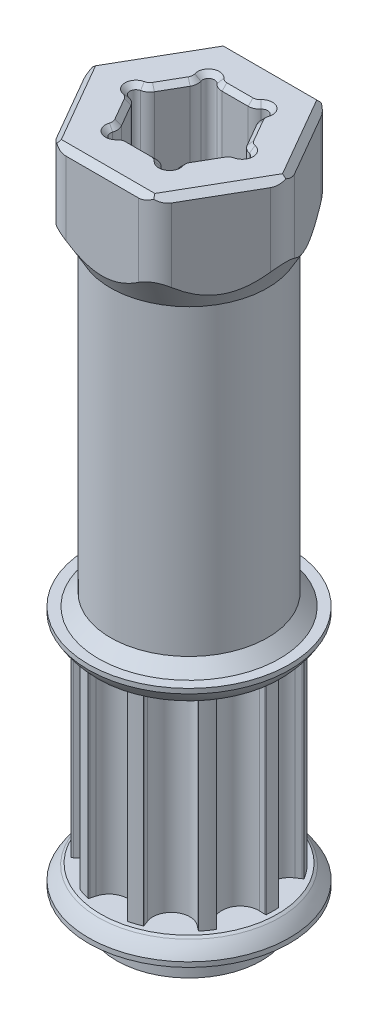
from build123d import *

# Parameters (mm, degrees)
SKETCH1_R           = 4.393648446
TOOTHOD_DEPTH       = 5.334
TOOTHPROFILE_DEPTH  = 9.189007835
TOOTHPATTERN_COUNT  = 10
BORE_DEPTH          = 10.804858556
BORE_DEPTH_BACK     = 10.804858556
SKETCH10_R          = 3.81
BOSS_EXTRUDE1_DEPTH = 1.524
SKETCH11_R          = 4.1275
BOSS_EXTRUDE2_DEPTH = 18.9738
BOSS_EXTRUDE3_DEPTH = 3.175
SKETCH12_R          = 0.3175
CUT_EXTRUDE1_DEPTH  = 38.132106473
FILLET1_R           = 0.635
CHAMFER2_SIZE       = 0.254
CHAMFER1_SIZE       = 0.635
CHAMFER3_SIZE       = 2.419674978
CHAMFER3_SIZE_2     = 1.397
CHAMFER4_SIZE       = 0.3175
FILLET2_R           = 1.27


with BuildPart() as part:
    # Sketch1 → ToothOD (new, symmetric)
    with BuildSketch(Plane(origin=(0, 0, 0), x_dir=(1, 0, 0), z_dir=(0, 1, 0))):
        with Locations(Location((0, 0, 0), (0, 0, 270))):
            Circle(SKETCH1_R)
    extrude(amount=TOOTHOD_DEPTH, both=True)

    # Sketch2 → ToothProfile (cut, symmetric)
    with BuildSketch(Plane(origin=(0, 0, 0), x_dir=(1, 0, 0), z_dir=(0, 1, 0))):
        with BuildLine():
            ThreePointArc((-0.937033068, 3.943710441), (-0.590385173, 3.425535831), (0, 3.225248446))
            ThreePointArc((0, 3.225248446), (0.590385173, 3.425535831), (0.937033068, 3.943710441))
            ThreePointArc((0.937033068, 3.943710441), (0.971699064, 4.069821903), (1.007805813, 4.195528446))
            ThreePointArc((1.007805813, 4.195528446), (1.021661234, 4.233200647), (1.040426249, 4.268683624))
            ThreePointArc((1.040426249, 4.268683624), (0, 4.393648446), (-1.040426249, 4.268683624))
            ThreePointArc((-1.040426249, 4.268683624), (-1.021661234, 4.233200647), (-1.007805813, 4.195528446))
            ThreePointArc((-1.007805813, 4.195528446), (-0.971699064, 4.069821903), (-0.937033068, 3.943710441))
        make_face()
    toothprofile = extrude(amount=TOOTHPROFILE_DEPTH, both=True, mode=Mode.SUBTRACT)

    # ToothPattern: ToothProfile ×10 about axis
    toothpattern_axis = Axis((0, 0, 0), (0, 1, 0))
    for i in range(1, TOOTHPATTERN_COUNT):
        add(toothprofile.rotate(toothpattern_axis, i * 360 / TOOTHPATTERN_COUNT), mode=Mode.SUBTRACT)

    # Sketch4 → Flange (revolve)
    with BuildSketch(Plane.XY, mode=Mode.PRIVATE) as flange_sk:
        with BuildLine():
            Line((0, -5.334), (4.647648446, -5.334))
            ThreePointArc((4.647648446, -5.334), (4.711861502, -5.379341157), (4.774648446, -5.426637424))
            ThreePointArc((4.774648446, -5.426637424), (5.050690043, -5.74459066), (5.282648446, -6.096))
            Line((5.282648446, -6.096), (5.282648446, -6.35))
            Line((5.282648446, -6.35), (0, -6.35))
            Line((0, -6.35), (0, -5.334))
        make_face()
        with BuildLine():
            Line((5.282648446, 6.35), (5.282648446, 6.096))
            ThreePointArc((5.282648446, 6.096), (5.050690043, 5.74459066), (4.774648446, 5.426637424))
            ThreePointArc((4.774648446, 5.426637424), (4.711861502, 5.379341157), (4.647648446, 5.334))
            Line((4.647648446, 5.334), (0, 5.334))
            Line((0, 5.334), (0, 6.35))
            Line((0, 6.35), (5.282648446, 6.35))
        make_face()
    revolve(flange_sk.sketch.rotate(Axis((0, 8.73125, 0), (0, -1, 0)), 90), axis=Axis((0, 8.73125, 0), (0, -1, 0)))

    # Sketch7 → Bore (cut, two sides: drawn at the far end of the back side and taken through both)
    with BuildSketch(Plane.XZ.offset(-BORE_DEPTH_BACK)):
        Polygon((1.396812374, 2.41935), (-1.396812374, 2.41935), (-2.793624748, 0), (-1.396812374, -2.41935), (1.396812374, -2.41935), (2.793624748, 0), align=None)
    extrude(amount=BORE_DEPTH + BORE_DEPTH_BACK, mode=Mode.SUBTRACT)

    # Sketch10 → Boss-Extrude1 (add)
    with BuildSketch(Plane.XZ.offset(6.35)):
        with Locations(Location((0, 0, 0), (0, 0, 90))):
            Circle(SKETCH10_R)
        Polygon((1.396812374, 2.41935), (-1.396812374, 2.41935), (-2.793624748, 0), (-1.396812374, -2.41935), (1.396812374, -2.41935), (2.793624748, 0), align=None, mode=Mode.SUBTRACT)
    extrude(amount=BOSS_EXTRUDE1_DEPTH)

    # Sketch11 → Boss-Extrude2 (add)
    with BuildSketch(Plane(origin=(0, 6.35, 0), x_dir=(1, 0, 0), z_dir=(0, 1, 0))):
        with Locations(Location((0, 0, 0), (0, 0, 90))):
            Circle(SKETCH11_R)
        Polygon((2.793624748, 0), (1.396812374, 2.41935), (-1.396812374, 2.41935), (-2.793624748, 0), (-1.396812374, -2.41935), (1.396812374, -2.41935), align=None, mode=Mode.SUBTRACT)
    extrude(amount=BOSS_EXTRUDE2_DEPTH)

    # Sketch14 → Boss-Extrude3 (add)
    with BuildSketch(Plane(origin=(0, 25.3238, 0), x_dir=(1, 0, 0), z_dir=(0, 1, 0))):
        Polygon((2.639645431, -4.572), (5.279290861, 0), (2.639645431, 4.572), (-2.639645431, 4.572), (-5.279290861, 0), (-2.639645431, -4.572), align=None)
        Polygon((-1.396812374, 2.41935), (-2.793624748, 0), (-1.396812374, -2.41935), (1.396812374, -2.41935), (2.793624748, 0), (1.396812374, 2.41935), align=None, mode=Mode.SUBTRACT)
    extrude(amount=BOSS_EXTRUDE3_DEPTH)

    # Sketch12 → Cut-Extrude1 (cut, through all)
    with BuildSketch(Plane.XZ.offset(7.874)):
        with Locations((-1.396812374, 2.41935)):
            Circle(SKETCH12_R)
        with Locations((1.396812374, 2.41935)):
            Circle(SKETCH12_R)
        with Locations((2.793624748, 0)):
            Circle(SKETCH12_R)
        with Locations((1.396812374, -2.41935)):
            Circle(SKETCH12_R)
        with Locations((-1.396812374, -2.41935)):
            Circle(SKETCH12_R)
        with Locations((-2.793624748, 0)):
            Circle(SKETCH12_R)
    extrude(amount=-CUT_EXTRUDE1_DEPTH, mode=Mode.SUBTRACT)

    # Fillet1
    fillet1_edges = [part.edges().sort_by_distance(p)[0] for p in [
        (-2.634874748, 10.3124, -0.274963066),
        (-2.634874748, 10.3124, 0.274963066),
        (-1.079312374, 10.3124, -2.41935),
        (-1.555562374, 10.3124, -2.144386934),
        (1.555562374, 10.3124, -2.144386934),
        (1.079312374, 10.3124, -2.41935),
        (2.634874748, 10.3124, 0.274963066),
        (2.634874748, 10.3124, -0.274963066),
        (1.555562374, 10.3124, 2.144386934),
        (1.079312374, 10.3124, 2.41935),
        (-1.555562374, 10.3124, 2.144386934),
        (-1.079312374, 10.3124, 2.41935),
    ]]
    fillet(fillet1_edges, radius=FILLET1_R)

    # Chamfer2
    chamfer2_edges = [part.edges().sort_by_distance(p)[0] for p in [
        (2.095218561, 28.4988, -1.209675),
        (2.095218561, -7.874, -1.209675),
        (-3.111124748, -7.874, 0),
        (-2.095218561, -7.874, 1.209675),
        (-1.555562374, -7.874, 2.694313066),
        (0, -7.874, 2.41935),
        (1.555562374, -7.874, 2.694313066),
        (2.095218561, -7.874, 1.209675),
        (3.111124748, -7.874, 0),
        (1.555562374, -7.874, -2.694313066),
        (0, -7.874, -2.41935),
        (-1.555562374, -7.874, -2.694313066),
        (-2.095218561, -7.874, -1.209675),
        (2.616182341, -7.874, -0.417993183),
        (2.616182341, -7.874, 0.417993183),
        (1.670083886, -7.874, 2.056683777),
        (0.946098455, -7.874, 2.47467696),
        (-0.946098455, -7.874, 2.47467696),
        (-1.670083886, -7.874, 2.056683777),
        (-2.616182341, -7.874, 0.417993183),
        (-2.616182341, -7.874, -0.417993183),
        (-1.670083886, -7.874, -2.056683777),
        (-0.946098455, -7.874, -2.47467696),
        (0.946098455, -7.874, -2.47467696),
        (1.670083886, -7.874, -2.056683777),
        (1.555562374, 28.4988, -2.694313066),
        (-3.111124748, 28.4988, 0),
        (-2.095218561, 28.4988, -1.209675),
        (-1.555562374, 28.4988, -2.694313066),
        (0, 28.4988, -2.41935),
        (3.111124748, 28.4988, 0),
        (2.095218561, 28.4988, 1.209675),
        (1.555562374, 28.4988, 2.694313066),
        (0, 28.4988, 2.41935),
        (-1.555562374, 28.4988, 2.694313066),
        (-2.095218561, 28.4988, 1.209675),
        (2.616182341, 28.4988, -0.417993183),
        (2.616182341, 28.4988, 0.417993183),
        (1.670083886, 28.4988, 2.056683777),
        (0.946098455, 28.4988, 2.47467696),
        (-0.946098455, 28.4988, 2.47467696),
        (-1.670083886, 28.4988, 2.056683777),
        (-2.616182341, 28.4988, 0.417993183),
        (-2.616182341, 28.4988, -0.417993183),
        (-1.670083886, 28.4988, -2.056683777),
        (-0.946098455, 28.4988, -2.47467696),
        (0.946098455, 28.4988, -2.47467696),
        (1.670083886, 28.4988, -2.056683777),
    ]]
    chamfer(chamfer2_edges, length=CHAMFER2_SIZE)

    # Chamfer1
    chamfer1_edges = [part.edges().sort_by_distance(p)[0] for p in [
        (0, -6.35, -3.81),
        (0, 6.35, 4.1275),
    ]]
    chamfer(chamfer1_edges, length=CHAMFER1_SIZE)

    # Chamfer3
    # the kernel refuses this chamfer: 2.419674978, 1.397 mm, written as the material it adds along each edge
    with BuildSketch(Plane(origin=(0, 25.3238, 0), x_dir=(0, 0, -1), z_dir=(1, 0, 0))) as chamfer3_piece_1_section:
        Polygon((4.1275, -CHAMFER3_SIZE), (4.1275 + CHAMFER3_SIZE_2, 0), (4.1275, 0), align=None)
    chamfer3_piece_1 = revolve(axis=Axis((0, 25.3238, 0), (0, 1, 0)), mode=Mode.PRIVATE)
    chamfer3_piece_1 = split(chamfer3_piece_1, bisect_by=Plane(origin=(3.959468146, 23.183533948, 2.286), z_dir=(-0.8660254037844387, 0, -0.49999999999999994)), keep=Keep.TOP, mode=Mode.PRIVATE)
    chamfer3_piece_1 = split(chamfer3_piece_1, bisect_by=Plane(origin=(-3.680693227, 23.183533948, 4.572), z_dir=(0, 0, -1)), keep=Keep.TOP, mode=Mode.PRIVATE)
    chamfer3_piece_1 = split(chamfer3_piece_1, bisect_by=Plane(origin=(2.119121533, 23.183533948, -5.473573838), z_dir=(-0.8660254037844387, 0, 0.5000000000000003)), keep=Keep.TOP, mode=Mode.PRIVATE)
    chamfer3_piece_1 = split(chamfer3_piece_1, bisect_by=Plane(origin=(-5.799814759, 23.183533948, -0.901573838), z_dir=(0.8660254037844387, 0, -0.5)), keep=Keep.TOP, mode=Mode.PRIVATE)
    chamfer3_piece_1 = split(chamfer3_piece_1, bisect_by=Plane(origin=(-3.680693227, 23.183533948, -4.572), z_dir=(0, 0, 1)), keep=Keep.TOP, mode=Mode.PRIVATE)
    chamfer3_piece_1 = split(chamfer3_piece_1, bisect_by=Plane(origin=(-3.959468146, 23.183533948, -2.286), z_dir=(0.8660254037844387, 0, 0.5000000000000001)), keep=Keep.TOP, mode=Mode.PRIVATE)
    add(chamfer3_piece_1)

    # Chamfer4
    chamfer4_edges = [part.edges().sort_by_distance(p)[0] for p in [
        (0, 28.4988, 4.572),
        (3.959468146, 28.4988, 2.286),
        (3.959468146, 28.4988, -2.286),
        (0, 28.4988, -4.572),
        (-3.959468146, 28.4988, -2.286),
        (-3.959468146, 28.4988, 2.286),
    ]]
    chamfer(chamfer4_edges, length=CHAMFER4_SIZE)

    # Fillet2
    fillet2_edges = [part.edges().sort_by_distance(p)[0] for p in [
        (-2.639645431, 26.540192657, -4.572),
        (-5.279290861, 26.540192657, 0),
        (-2.639645431, 26.540192657, 4.572),
        (2.639645431, 26.540192657, 4.572),
        (5.279290861, 26.540192657, 0),
        (2.639645431, 26.540192657, -4.572),
    ]]
    fillet(fillet2_edges, radius=FILLET2_R)


solid = part.part
